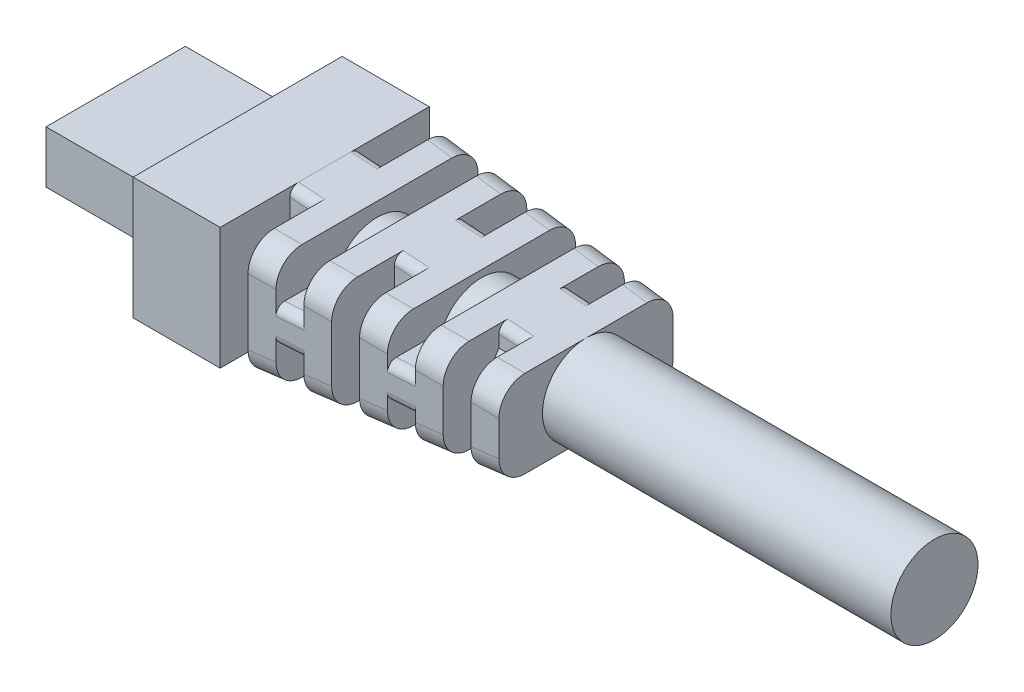
from build123d import *
from OCP.BRepFilletAPI import BRepFilletAPI_MakeChamfer

# Parameters (mm, degrees)
SKETCH_1_W           = 7
SKETCH_1_H           = 3
EXTRUDE_1_DEPTH      = 8
SKETCH_2_W           = 12
SKETCH_2_H           = 7
EXTRUDE_2_DEPTH      = 20
CHAMFER_1_SIZE       = 15
CHAMFER_1_SIZE2      = 1
SKETCH_4_W           = 1.5
SKETCH_4_H           = 2.5
SKETCH_4_H_2         = 2.51354888
SKETCH_4_H_3         = 2.48645112
CUT_EXTRUDE_1_DEPTH  = 4
FILLET_1_R           = 1.5
SKETCH_9_W           = 1.5
SKETCH_9_H           = 2
CUT_EXTRUDE_3_DEPTH  = 4
SKETCH_10_W          = 1.5
SKETCH_10_H          = 4
CUT_EXTRUDE_4_DEPTH  = 2.5
EXTRUDE_3_DEPTH      = 20
EXTRUDE_3_DEPTH_BACK = 20
SKETCH_11_R          = 2.5
FILLET_2_R           = 0.5
FILLET_3_R           = 0.5
FILLET_4_R           = 0.5
FILLET_5_R           = 0.5


with BuildPart() as part:
    # Эскиз1 → Бобышка-Вытянуть1 (new body)
    with BuildSketch(Plane.XY):
        with Locations((3.5, 1.5)):
            Rectangle(SKETCH_1_W, SKETCH_1_H)
    extrude(amount=EXTRUDE_1_DEPTH)

    # Эскиз2 → Бобышка-Вытянуть2 (add)
    with BuildSketch(Plane(origin=(7, 0, 0), x_dir=(0, 0, -1), z_dir=(1, 0, 0))):
        with Locations((-4, 1.5)):
            Rectangle(SKETCH_2_W, SKETCH_2_H)
    extrude(amount=EXTRUDE_2_DEPTH)

    # Фаска1: one chamfer whose edges measure the first distance from different faces: ONE call of the kernel's chamfer builder (chamfer() names one face for all edges)
    chamfer_1_edges_1 = [part.edges().sort_by_distance(p)[0] for p in [
        (27, 1.5, 10),
    ]]
    chamfer_1_side_1 = [part.faces().sort_by_distance(p)[0] for p in [
        (17, 1.5, 10),
    ]]
    chamfer_1_edges_2 = [part.edges().sort_by_distance(p)[0] for p in [
        (27, -2, 4),
    ]]
    chamfer_1_side_2 = [part.faces().sort_by_distance(p)[0] for p in [
        (17, -2, 4),
    ]]
    chamfer_1_edges_3 = [part.edges().sort_by_distance(p)[0] for p in [
        (27, 1.5, -2),
    ]]
    chamfer_1_side_3 = [part.faces().sort_by_distance(p)[0] for p in [
        (17, 1.5, -2),
    ]]
    chamfer_1_edges_4 = [part.edges().sort_by_distance(p)[0] for p in [
        (27, 5, 4),
    ]]
    chamfer_1_side_4 = [part.faces().sort_by_distance(p)[0] for p in [
        (17, 5, 4),
    ]]
    chamfer_1 = BRepFilletAPI_MakeChamfer(part.part.solid().wrapped)
    for e in chamfer_1_edges_1:
        chamfer_1.Add(CHAMFER_1_SIZE, CHAMFER_1_SIZE2, e.wrapped, chamfer_1_side_1[0].wrapped)  # the first distance lies on this face
    for e in chamfer_1_edges_2:
        chamfer_1.Add(CHAMFER_1_SIZE, CHAMFER_1_SIZE2, e.wrapped, chamfer_1_side_2[0].wrapped)  # the first distance lies on this face
    for e in chamfer_1_edges_3:
        chamfer_1.Add(CHAMFER_1_SIZE, CHAMFER_1_SIZE2, e.wrapped, chamfer_1_side_3[0].wrapped)  # the first distance lies on this face
    for e in chamfer_1_edges_4:
        chamfer_1.Add(CHAMFER_1_SIZE, CHAMFER_1_SIZE2, e.wrapped, chamfer_1_side_4[0].wrapped)  # the first distance lies on this face
    add(Compound.cast(chamfer_1.Shape()), mode=Mode.REPLACE)

    # Эскиз4 → Вырез-Вытянуть1 (cut)
    with BuildSketch(Plane(origin=(0, 0, -2), x_dir=(-1, 0, 0), z_dir=(0, 0, -1))):
        with Locations((-24.75, 3.73645112)):
            Rectangle(SKETCH_4_W, SKETCH_4_H)
        with Locations((-21.75, 3.73645112)):
            Rectangle(SKETCH_4_W, SKETCH_4_H)
        with Locations((-18.75, 3.73645112)):
            Rectangle(SKETCH_4_W, SKETCH_4_H)
        with Locations((-15.75, 3.73645112)):
            Rectangle(SKETCH_4_W, SKETCH_4_H)
        with Locations((-12.75, 3.74322556)):
            Rectangle(SKETCH_4_W, SKETCH_4_H_2)
        with Locations((-21.75, -0.76354888)):
            Rectangle(SKETCH_4_W, SKETCH_4_H)
        with Locations((-18.75, -0.76354888)):
            Rectangle(SKETCH_4_W, SKETCH_4_H)
        with Locations((-15.75, -0.76354888)):
            Rectangle(SKETCH_4_W, SKETCH_4_H)
        with Locations((-12.75, -0.75677444)):
            Rectangle(SKETCH_4_W, SKETCH_4_H_3)
        with Locations((-24.75, -0.76354888)):
            Rectangle(SKETCH_4_W, SKETCH_4_H)
    cut_extrude_1 = extrude(amount=-CUT_EXTRUDE_1_DEPTH, mode=Mode.SUBTRACT)

    # Зеркальное отражение1: Вырез-Вытянуть1 across plane
    add(cut_extrude_1.mirror(Plane.XY.offset(4)), mode=Mode.SUBTRACT)

    # Скругление1
    fillet_1_edges = [part.edges().sort_by_distance(p)[0] for p in [
        (20.25, -1.45, -1.45),
        (17.25, -1.65, -1.65),
        (14.25, -1.85, -1.85),
        (23.25, -1.25, -1.25),
        (26.25, 4.05, 9.05),
        (23.25, 4.25, 9.25),
        (20.25, 4.45, 9.45),
        (17.25, 4.65, 9.65),
        (14.25, 4.85, 9.85),
        (23.25, -1.25, 9.25),
        (20.25, -1.45, 9.45),
        (17.25, -1.65, 9.65),
        (26.25, -1.05, -1.05),
        (14.25, -1.85, 9.85),
        (26.25, 4.05, -1.05),
        (26.25, -1.05, 9.05),
        (23.25, 4.25, -1.25),
        (20.25, 4.45, -1.45),
        (17.25, 4.65, -1.65),
        (14.25, 4.85, -1.85),
    ]]
    fillet(fillet_1_edges, radius=FILLET_1_R)

    # Эскиз9 → Вырез-Вытянуть3 (cut)
    with BuildSketch(Plane.XY.offset(10)):
        with Locations((12.75, 1.48645112)):
            Rectangle(SKETCH_9_W, SKETCH_9_H)
        with Locations((18.75, 1.48645112)):
            Rectangle(SKETCH_9_W, SKETCH_9_H)
        with Locations((24.75, 1.48645112)):
            Rectangle(SKETCH_9_W, SKETCH_9_H)
    cut_extrude_3 = extrude(amount=-CUT_EXTRUDE_3_DEPTH, mode=Mode.SUBTRACT)

    # Зеркальное отражение2: Вырез-Вытянуть3 across plane
    add(cut_extrude_3.mirror(Plane.XY.offset(4)), mode=Mode.SUBTRACT)

    # Эскиз10 → Вырез-Вытянуть4 (cut)
    with BuildSketch(Plane(origin=(0, 5, 0), x_dir=(1, 0, 0), z_dir=(0, 1, 0))):
        with Locations((15.75, -4)):
            Rectangle(SKETCH_10_W, SKETCH_10_H)
        with Locations((21.75, -4)):
            Rectangle(SKETCH_10_W, SKETCH_10_H)
    cut_extrude_4 = extrude(amount=-CUT_EXTRUDE_4_DEPTH, mode=Mode.SUBTRACT)

    # Зеркальное отражение3: Вырез-Вытянуть4 across plane
    add(cut_extrude_4.mirror(Plane.ZX.offset(1.5)), mode=Mode.SUBTRACT)

    # Эскиз11 → Бобышка-Вытянуть3 (add, two sides: drawn at the far end of the back side and taken through both)
    with BuildSketch(Plane(origin=(27, 0, 0), x_dir=(0, 0, -1), z_dir=(1, 0, 0)).offset(-EXTRUDE_3_DEPTH_BACK)):
        with Locations(Location((-4, 1.5, 0), (0, 0, 270))):
            Circle(SKETCH_11_R)
    extrude(amount=EXTRUDE_3_DEPTH + EXTRUDE_3_DEPTH_BACK)

    # Скругление2
    # the kernel refuses this fillet: 0.5 mm, written as the material it takes off along each edge
    with BuildSketch(Plane(origin=(20.747231447, -1.416851237, 2), x_dir=(-0.06651901052377394, 0.997785157856609, 0), z_dir=(-0.9977851578566089, -0.06651901052377394, 0))) as fillet_2_piece_1_section:
        with BuildLine():
            CenterArc((FILLET_2_R, -FILLET_2_R), FILLET_2_R, 90, 90)
            Line((0, -FILLET_2_R), (0, 0))
            Line((0, 0), (FILLET_2_R, 0))
        make_face()
    fillet_2_piece_1 = extrude(amount=4.003329638, mode=Mode.PRIVATE)
    fillet_2_piece_1 = split(fillet_2_piece_1, bisect_by=Plane(origin=(19.5, -1.436551172, 2.113197557), z_dir=(-1, 0, 0)), keep=Keep.TOP, mode=Mode.PRIVATE)
    fillet_2_piece_1 = split(fillet_2_piece_1, bisect_by=Plane(origin=(18, -1.436551172, 2.113197557), z_dir=(1, 0, 0)), keep=Keep.TOP, mode=Mode.PRIVATE)
    add(fillet_2_piece_1, mode=Mode.SUBTRACT)
    with BuildSketch(Plane(origin=(14.747231447, -1.816851237, 2), x_dir=(0, 0, 1), z_dir=(-0.9977851578566089, -0.06651901052377394, 0))) as fillet_2_piece_2_section:
        with BuildLine():
            CenterArc((FILLET_2_R, FILLET_2_R), FILLET_2_R, 180, 90)
            Line((0, FILLET_2_R), (0, 0))
            Line((0, 0), (FILLET_2_R, 0))
        make_face()
    fillet_2_piece_2 = extrude(amount=4.003329638, mode=Mode.PRIVATE)
    fillet_2_piece_2 = split(fillet_2_piece_2, bisect_by=Plane(origin=(12, -1.836551172, 2.113197557), z_dir=(1, 0, 0)), keep=Keep.TOP, mode=Mode.PRIVATE)
    fillet_2_piece_2 = split(fillet_2_piece_2, bisect_by=Plane(origin=(13.5, -1.836551172, 2.113197557), z_dir=(-1, 0, 0)), keep=Keep.TOP, mode=Mode.PRIVATE)
    add(fillet_2_piece_2, mode=Mode.SUBTRACT)
    with BuildSketch(Plane(origin=(26.747231447, -1.016851237, 2), x_dir=(0, 0, 1), z_dir=(-0.9977851578566089, -0.06651901052377394, 0))) as fillet_2_piece_3_section:
        with BuildLine():
            CenterArc((FILLET_2_R, FILLET_2_R), FILLET_2_R, 180, 90)
            Line((0, FILLET_2_R), (0, 0))
            Line((0, 0), (FILLET_2_R, 0))
        make_face()
    fillet_2_piece_3 = extrude(amount=4.003329638, mode=Mode.PRIVATE)
    fillet_2_piece_3 = split(fillet_2_piece_3, bisect_by=Plane(origin=(25.5, -1.036551172, 2.113197557), z_dir=(-1, 0, 0)), keep=Keep.TOP, mode=Mode.PRIVATE)
    fillet_2_piece_3 = split(fillet_2_piece_3, bisect_by=Plane(origin=(24, -1.036551172, 2.113197557), z_dir=(1, 0, 0)), keep=Keep.TOP, mode=Mode.PRIVATE)
    add(fillet_2_piece_3, mode=Mode.SUBTRACT)
    with BuildSketch(Plane(origin=(20.747231447, -1.416851237, 6), x_dir=(0, 0, -1), z_dir=(-0.9977851578566089, -0.06651901052377394, 0))) as fillet_2_piece_4_section:
        with BuildLine():
            CenterArc((FILLET_2_R, -FILLET_2_R), FILLET_2_R, 90, 90)
            Line((0, -FILLET_2_R), (0, 0))
            Line((0, 0), (FILLET_2_R, 0))
        make_face()
    fillet_2_piece_4 = extrude(amount=4.003329638, mode=Mode.PRIVATE)
    fillet_2_piece_4 = split(fillet_2_piece_4, bisect_by=Plane(origin=(18, -1.436551172, 5.886802443), z_dir=(1, 0, 0)), keep=Keep.TOP, mode=Mode.PRIVATE)
    fillet_2_piece_4 = split(fillet_2_piece_4, bisect_by=Plane(origin=(19.5, -1.436551172, 5.886802443), z_dir=(-1, 0, 0)), keep=Keep.TOP, mode=Mode.PRIVATE)
    add(fillet_2_piece_4, mode=Mode.SUBTRACT)
    with BuildSketch(Plane(origin=(14.747231447, -1.816851237, 6), x_dir=(0, 0, -1), z_dir=(-0.9977851578566089, -0.06651901052377394, 0))) as fillet_2_piece_5_section:
        with BuildLine():
            CenterArc((FILLET_2_R, -FILLET_2_R), FILLET_2_R, 90, 90)
            Line((0, -FILLET_2_R), (0, 0))
            Line((0, 0), (FILLET_2_R, 0))
        make_face()
    fillet_2_piece_5 = extrude(amount=4.003329638, mode=Mode.PRIVATE)
    fillet_2_piece_5 = split(fillet_2_piece_5, bisect_by=Plane(origin=(12, -1.836551172, 5.886802443), z_dir=(1, 0, 0)), keep=Keep.TOP, mode=Mode.PRIVATE)
    fillet_2_piece_5 = split(fillet_2_piece_5, bisect_by=Plane(origin=(13.5, -1.836551172, 5.886802443), z_dir=(-1, 0, 0)), keep=Keep.TOP, mode=Mode.PRIVATE)
    add(fillet_2_piece_5, mode=Mode.SUBTRACT)
    with BuildSketch(Plane(origin=(26.747231447, -1.016851237, 6), x_dir=(0, 0, -1), z_dir=(-0.9977851578566089, -0.06651901052377394, 0))) as fillet_2_piece_6_section:
        with BuildLine():
            CenterArc((FILLET_2_R, -FILLET_2_R), FILLET_2_R, 90, 90)
            Line((0, -FILLET_2_R), (0, 0))
            Line((0, 0), (FILLET_2_R, 0))
        make_face()
    fillet_2_piece_6 = extrude(amount=4.003329638, mode=Mode.PRIVATE)
    fillet_2_piece_6 = split(fillet_2_piece_6, bisect_by=Plane(origin=(24, -1.036551172, 5.886802443), z_dir=(1, 0, 0)), keep=Keep.TOP, mode=Mode.PRIVATE)
    fillet_2_piece_6 = split(fillet_2_piece_6, bisect_by=Plane(origin=(25.5, -1.036551172, 5.886802443), z_dir=(-1, 0, 0)), keep=Keep.TOP, mode=Mode.PRIVATE)
    add(fillet_2_piece_6, mode=Mode.SUBTRACT)

    # Скругление3
    fillet_3_edges = [part.edges().sort_by_distance(p)[0] for p in [
        (21.75, 2.48645112, 9.35),
        (15.75, 2.48645112, 9.75),
        (21.75, 0.48645112, 9.35),
        (15.75, 0.48645112, 9.75),
    ]]
    fillet(fillet_3_edges, radius=FILLET_3_R)

    # Скругление4
    # the kernel refuses this fillet: 0.5 mm, written as the material it takes off along each edge
    with BuildSketch(Plane(origin=(14.747231447, 4.816851237, 2), x_dir=(0, 0, 1), z_dir=(-0.9977851578566089, 0.06651901052377394, 0))) as fillet_4_piece_1_section:
        with BuildLine():
            CenterArc((FILLET_4_R, -FILLET_4_R), FILLET_4_R, 90, 90)
            Line((0, -FILLET_4_R), (0, 0))
            Line((0, 0), (FILLET_4_R, 0))
        make_face()
    fillet_4_piece_1 = extrude(amount=4.003329638, mode=Mode.PRIVATE)
    fillet_4_piece_1 = split(fillet_4_piece_1, bisect_by=Plane(origin=(12, 4.836551172, 2.113197557), z_dir=(1, 0, 0)), keep=Keep.TOP, mode=Mode.PRIVATE)
    fillet_4_piece_1 = split(fillet_4_piece_1, bisect_by=Plane(origin=(13.5, 4.836551172, 2.113197557), z_dir=(-1, 0, 0)), keep=Keep.TOP, mode=Mode.PRIVATE)
    add(fillet_4_piece_1, mode=Mode.SUBTRACT)
    with BuildSketch(Plane(origin=(22.752768553, 4.283148763, 6), x_dir=(0, 0, -1), z_dir=(0.9977851578566089, -0.06651901052377394, 0))) as fillet_4_piece_2_section:
        with BuildLine():
            CenterArc((FILLET_4_R, -FILLET_4_R), FILLET_4_R, 90, 90)
            Line((0, -FILLET_4_R), (0, 0))
            Line((0, 0), (FILLET_4_R, 0))
        make_face()
    fillet_4_piece_2 = extrude(amount=4.003329638, mode=Mode.PRIVATE)
    fillet_4_piece_2 = split(fillet_4_piece_2, bisect_by=Plane(origin=(25.5, 4.036551172, 5.886802443), z_dir=(-1, 0, 0)), keep=Keep.TOP, mode=Mode.PRIVATE)
    fillet_4_piece_2 = split(fillet_4_piece_2, bisect_by=Plane(origin=(24, 4.036551172, 5.886802443), z_dir=(1, 0, 0)), keep=Keep.TOP, mode=Mode.PRIVATE)
    add(fillet_4_piece_2, mode=Mode.SUBTRACT)
    with BuildSketch(Plane(origin=(16.752768553, 4.683148763, 6), x_dir=(-0.06651901052377394, -0.997785157856609, 0), z_dir=(0.9977851578566089, -0.06651901052377394, 0))) as fillet_4_piece_3_section:
        with BuildLine():
            CenterArc((FILLET_4_R, FILLET_4_R), FILLET_4_R, 180, 90)
            Line((0, FILLET_4_R), (0, 0))
            Line((0, 0), (FILLET_4_R, 0))
        make_face()
    fillet_4_piece_3 = extrude(amount=4.003329638, mode=Mode.PRIVATE)
    fillet_4_piece_3 = split(fillet_4_piece_3, bisect_by=Plane(origin=(18, 4.436551172, 5.886802443), z_dir=(1, 0, 0)), keep=Keep.TOP, mode=Mode.PRIVATE)
    fillet_4_piece_3 = split(fillet_4_piece_3, bisect_by=Plane(origin=(19.5, 4.436551172, 5.886802443), z_dir=(-1, 0, 0)), keep=Keep.TOP, mode=Mode.PRIVATE)
    add(fillet_4_piece_3, mode=Mode.SUBTRACT)
    with BuildSketch(Plane(origin=(14.747231447, 4.816851237, 6), x_dir=(0, 0, -1), z_dir=(-0.9977851578566089, 0.06651901052377394, 0))) as fillet_4_piece_4_section:
        with BuildLine():
            CenterArc((FILLET_4_R, FILLET_4_R), FILLET_4_R, 180, 90)
            Line((0, FILLET_4_R), (0, 0))
            Line((0, 0), (FILLET_4_R, 0))
        make_face()
    fillet_4_piece_4 = extrude(amount=4.003329638, mode=Mode.PRIVATE)
    fillet_4_piece_4 = split(fillet_4_piece_4, bisect_by=Plane(origin=(13.5, 4.836551172, 5.886802443), z_dir=(-1, 0, 0)), keep=Keep.TOP, mode=Mode.PRIVATE)
    fillet_4_piece_4 = split(fillet_4_piece_4, bisect_by=Plane(origin=(12, 4.836551172, 5.886802443), z_dir=(1, 0, 0)), keep=Keep.TOP, mode=Mode.PRIVATE)
    add(fillet_4_piece_4, mode=Mode.SUBTRACT)
    with BuildSketch(Plane(origin=(22.752768553, 4.283148763, 2), x_dir=(0, 0, 1), z_dir=(0.9977851578566089, -0.06651901052377394, 0))) as fillet_4_piece_5_section:
        with BuildLine():
            CenterArc((FILLET_4_R, FILLET_4_R), FILLET_4_R, 180, 90)
            Line((0, FILLET_4_R), (0, 0))
            Line((0, 0), (FILLET_4_R, 0))
        make_face()
    fillet_4_piece_5 = extrude(amount=4.003329638, mode=Mode.PRIVATE)
    fillet_4_piece_5 = split(fillet_4_piece_5, bisect_by=Plane(origin=(24, 4.036551172, 2.113197557), z_dir=(1, 0, 0)), keep=Keep.TOP, mode=Mode.PRIVATE)
    fillet_4_piece_5 = split(fillet_4_piece_5, bisect_by=Plane(origin=(25.5, 4.036551172, 2.113197557), z_dir=(-1, 0, 0)), keep=Keep.TOP, mode=Mode.PRIVATE)
    add(fillet_4_piece_5, mode=Mode.SUBTRACT)
    with BuildSketch(Plane(origin=(16.752768553, 4.683148763, 2), x_dir=(0, 0, 1), z_dir=(0.9977851578566089, -0.06651901052377394, 0))) as fillet_4_piece_6_section:
        with BuildLine():
            CenterArc((FILLET_4_R, FILLET_4_R), FILLET_4_R, 180, 90)
            Line((0, FILLET_4_R), (0, 0))
            Line((0, 0), (FILLET_4_R, 0))
        make_face()
    fillet_4_piece_6 = extrude(amount=4.003329638, mode=Mode.PRIVATE)
    fillet_4_piece_6 = split(fillet_4_piece_6, bisect_by=Plane(origin=(19.5, 4.436551172, 2.113197557), z_dir=(-1, 0, 0)), keep=Keep.TOP, mode=Mode.PRIVATE)
    fillet_4_piece_6 = split(fillet_4_piece_6, bisect_by=Plane(origin=(18, 4.436551172, 2.113197557), z_dir=(1, 0, 0)), keep=Keep.TOP, mode=Mode.PRIVATE)
    add(fillet_4_piece_6, mode=Mode.SUBTRACT)

    # Скругление5
    fillet_5_edges = [part.edges().sort_by_distance(p)[0] for p in [
        (21.75, 0.48645112, -1.35),
        (15.75, 0.48645112, -1.75),
        (21.75, 2.48645112, -1.35),
        (15.75, 2.48645112, -1.75),
    ]]
    fillet(fillet_5_edges, radius=FILLET_5_R)


solid = part.part
